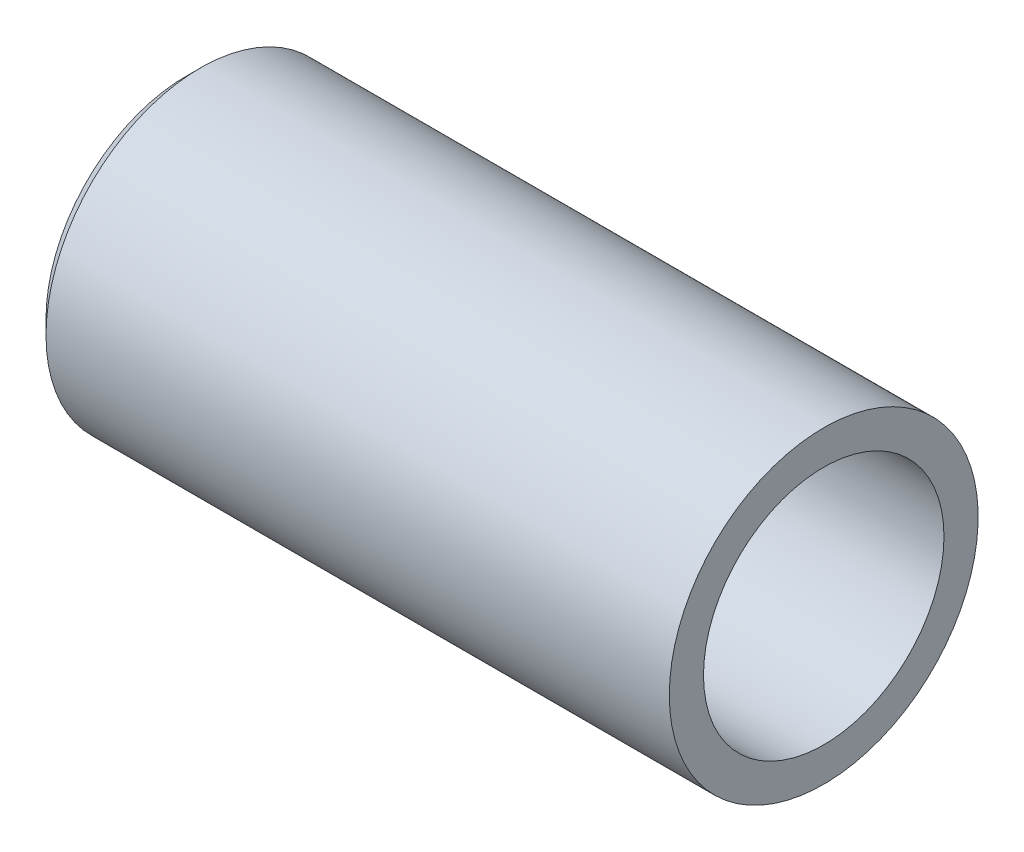
from build123d import *


with BuildPart() as part:
    # Sketch1 → Revolve1 (revolve)
    with BuildSketch(Plane.XY):
        Polygon((3.003306228, 5.422749886), (24.892, 5.422749886), (24.892, 4.22275), (2.50625, 4.22275), (2.50625, 4.925693658), align=None)
    revolve(axis=Axis((0, 0, 0), (1, 0, 0)))


solid = part.part
